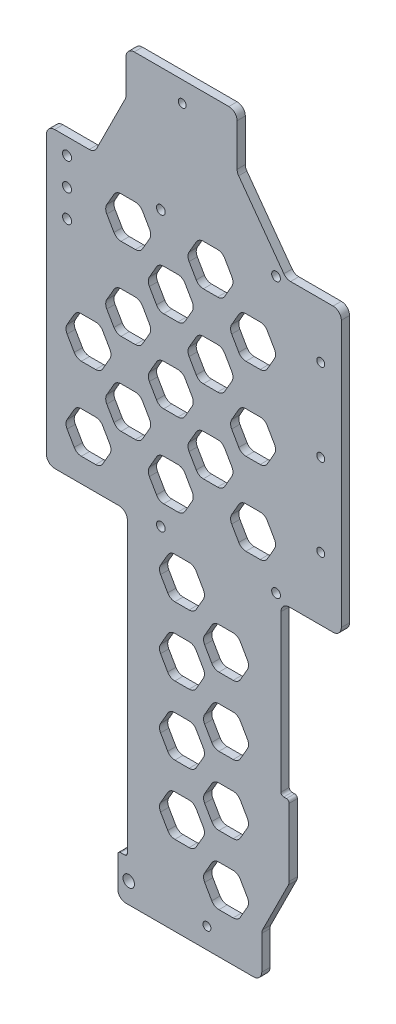
from build123d import *

# Parameters (mm, degrees)
SKETCH_1_R          = 2.1
EXTRUDE_1_DEPTH     = 3
SKETCH_2_R          = 1.45
CUT_EXTRUDE_1_DEPTH = 467.15301821
FILLET_2_R          = 3
FILLET_4_R          = 1
SKETCH_3_R          = 1.6
SKETCH_3_R_2        = 1.65
CUT_EXTRUDE_2_DEPTH = 467.15301821
CUT_EXTRUDE_3_DEPTH = 467.15301821
FILLET_5_R          = 3
SKETCH_6_W          = 103.390482882
SKETCH_6_H          = 284.084054078
CUT_EXTRUDE_5_DEPTH = 467.15301821
FILLET_7_R          = 3


with BuildPart() as part:
    # 草图1 → 凸台-拉伸1 (new body)
    with BuildSketch(Plane.XY):
        Polygon((260.5, -262.80151519), (266.5, -262.80151519), (266.5, -247.80151519), (263, -247.80151519), (263, -138.548780488), (307, -138.548780488), (307, -188.548780488), (307, -247.80151519), (303.5, -247.80151519), (303.5, -262.80151519), (307, -262.80151519), (356, -262.80151519), (356, -246.85724328), (366, -226.85724328), (366, -200.5), (363, -200.5), (363, -139.5), (385, -139.5), (385, -36.5), (364.963101633, -36.5), (347, -11.800735254), (347, 7.5), (306.5, 7.5), (306.5, -8.44427191), (294.972135955, -31.5), (275.027864045, -31.5), (263.5, -8.44427191), (263.5, 7.5), (223, 7.5), (223, -11.800735254), (205.036898367, -36.5), (185, -36.5), (185, -139.5), (207, -139.5), (207, -200.5), (204, -200.5), (204, -226.85724328), (214, -246.85724328), (214, -262.80151519), align=None)
        with Locations((262.5, -255.30151519)):
            Circle(SKETCH_1_R, mode=Mode.SUBTRACT)
        with Locations((307.5, -255.30151519)):
            Circle(SKETCH_1_R, mode=Mode.SUBTRACT)
    extrude(amount=EXTRUDE_1_DEPTH)

    # 草图2 → 切除-拉伸1 (cut, through all)
    with BuildSketch(Plane.XY.offset(3)):
        with Locations((192.5, -56.5)):
            Circle(SKETCH_2_R)
        with Locations((192.5, -86.5)):
            Circle(SKETCH_2_R)
        with Locations((192.5, -116.5)):
            Circle(SKETCH_2_R)
        with Locations((243, 0)):
            Circle(SKETCH_2_R)
        with Locations((234, -255.30151519)):
            Circle(SKETCH_2_R)
        with Locations((377.5, -56.5)):
            Circle(SKETCH_2_R)
        with Locations((327, 0)):
            Circle(SKETCH_2_R)
        with Locations((377.5, -86.5)):
            Circle(SKETCH_2_R)
        with Locations((377.5, -116.5)):
            Circle(SKETCH_2_R)
        with Locations((336, -255.30151519)):
            Circle(SKETCH_2_R)
    extrude(amount=-CUT_EXTRUDE_1_DEPTH, mode=Mode.SUBTRACT)

    # 圆角2
    fillet_2_edges = [part.edges().sort_by_distance(p)[0] for p in [
        (214, -262.80151519, 1.5),
        (214, -246.85724328, 1.5),
        (204, -226.85724328, 1.5),
        (207, -139.5, 1.5),
        (185, -139.5, 1.5),
        (185, -36.5, 1.5),
        (205.036898367, -36.5, 1.5),
        (223, -11.800735254, 1.5),
        (223, 7.5, 1.5),
        (263.5, 7.5, 1.5),
        (263.5, -8.44427191, 1.5),
        (275.027864045, -31.5, 1.5),
        (294.972135955, -31.5, 1.5),
        (306.5, -8.44427191, 1.5),
        (306.5, 7.5, 1.5),
        (347, 7.5, 1.5),
        (385, -36.5, 1.5),
        (385, -139.5, 1.5),
        (363, -139.5, 1.5),
        (366, -226.85724328, 1.5),
        (356, -246.85724328, 1.5),
        (356, -262.80151519, 1.5),
        (347, -11.800735254, 1.5),
        (364.963101633, -36.5, 1.5),
        (303.5, -262.80151519, 1.5),
        (266.5, -262.80151519, 1.5),
        (307, -138.548780488, 1.5),
        (263, -138.548780488, 1.5),
    ]]
    fillet(fillet_2_edges, radius=FILLET_2_R)

    # 圆角4
    fillet_4_edges = [part.edges().sort_by_distance(p)[0] for p in [
        (204, -200.5, 1.5),
        (207, -200.5, 1.5),
        (366, -200.5, 1.5),
        (363, -200.5, 1.5),
        (307, -247.80151519, 1.5),
        (303.5, -247.80151519, 1.5),
        (263, -247.80151519, 1.5),
        (266.5, -247.80151519, 1.5),
    ]]
    fillet(fillet_4_edges, radius=FILLET_4_R)

    # 草图3 → 切除-拉伸2 (cut, through all)
    with BuildSketch(Plane.XY.offset(3)):
        with Locations((319.201373461, -37.5)):
            Circle(SKETCH_3_R)
        with Locations((361.201373461, -37.5)):
            Circle(SKETCH_3_R)
        with Locations((361.201373461, -137.5)):
            Circle(SKETCH_3_R)
        with Locations((319.201373461, -137.5)):
            Circle(SKETCH_3_R)
        with Locations((285, -37.5)):
            Circle(SKETCH_3_R_2)
        with Locations((285, -47.5)):
            Circle(SKETCH_3_R_2)
        with Locations((285, -57.5)):
            Circle(SKETCH_3_R_2)
    extrude(amount=-CUT_EXTRUDE_2_DEPTH, mode=Mode.SUBTRACT)

    # 草图4 → 切除-拉伸3 (cut, through all)
    with BuildSketch(Plane.XY.offset(3)):
        Polygon((255.960695247, -47.20116792), (251.630568228, -39.70116792), (242.97031419, -39.70116792), (238.640187171, -47.20116792), (242.97031419, -54.70116792), (251.630568228, -54.70116792), align=None)
        Polygon((225.960695247, -47.20116792), (221.630568228, -39.70116792), (212.97031419, -39.70116792), (208.640187171, -47.20116792), (212.97031419, -54.70116792), (221.630568228, -54.70116792), align=None)
        Polygon((241.48162596, -62.318127345), (237.151498941, -54.818127345), (228.491244903, -54.818127345), (224.161117884, -62.318127345), (228.491244903, -69.818127345), (237.151498941, -69.818127345), align=None)
        Polygon((271.48162596, -62.318127345), (267.151498941, -54.818127345), (258.491244903, -54.818127345), (254.161117884, -62.318127345), (258.491244903, -69.818127345), (267.151498941, -69.818127345), align=None)
        Polygon((315.960695247, -47.20116792), (311.630568228, -39.70116792), (302.97031419, -39.70116792), (298.640187171, -47.20116792), (302.97031419, -54.70116792), (311.630568228, -54.70116792), align=None)
        Polygon((331.48162596, -62.318127345), (327.151498941, -54.818127345), (318.491244903, -54.818127345), (314.161117884, -62.318127345), (318.491244903, -69.818127345), (327.151498941, -69.818127345), align=None)
        Polygon((345.960695247, -47.20116792), (341.630568228, -39.70116792), (332.97031419, -39.70116792), (328.640187171, -47.20116792), (332.97031419, -54.70116792), (341.630568228, -54.70116792), align=None)
        Polygon((361.48162596, -62.318127345), (357.151498941, -54.818127345), (348.491244903, -54.818127345), (344.161117884, -62.318127345), (348.491244903, -69.818127345), (357.151498941, -69.818127345), align=None)
        Polygon((255.960695247, -77.20116792), (251.630568228, -69.70116792), (242.97031419, -69.70116792), (238.640187171, -77.20116792), (242.97031419, -84.70116792), (251.630568228, -84.70116792), align=None)
        Polygon((271.48162596, -92.318127345), (267.151498941, -84.818127345), (258.491244903, -84.818127345), (254.161117884, -92.318127345), (258.491244903, -99.818127345), (267.151498941, -99.818127345), align=None)
        Polygon((301.48162596, -92.318127345), (297.151498941, -84.818127345), (288.491244903, -84.818127345), (284.161117884, -92.318127345), (288.491244903, -99.818127345), (297.151498941, -99.818127345), align=None)
        Polygon((315.960695247, -77.20116792), (311.630568228, -69.70116792), (302.97031419, -69.70116792), (298.640187171, -77.20116792), (302.97031419, -84.70116792), (311.630568228, -84.70116792), align=None)
        Polygon((331.48162596, -92.318127345), (327.151498941, -84.818127345), (318.491244903, -84.818127345), (314.161117884, -92.318127345), (318.491244903, -99.818127345), (327.151498941, -99.818127345), align=None)
        Polygon((345.960695247, -77.20116792), (341.630568228, -69.70116792), (332.97031419, -69.70116792), (328.640187171, -77.20116792), (332.97031419, -84.70116792), (341.630568228, -84.70116792), align=None)
        Polygon((361.48162596, -92.318127345), (357.151498941, -84.818127345), (348.491244903, -84.818127345), (344.161117884, -92.318127345), (348.491244903, -99.818127345), (357.151498941, -99.818127345), align=None)
        Polygon((255.960695247, -107.20116792), (251.630568228, -99.70116792), (242.97031419, -99.70116792), (238.640187171, -107.20116792), (242.97031419, -114.70116792), (251.630568228, -114.70116792), align=None)
        Polygon((271.48162596, -122.318127345), (267.151498941, -114.818127345), (258.491244903, -114.818127345), (254.161117884, -122.318127345), (258.491244903, -129.818127345), (267.151498941, -129.818127345), align=None)
        Polygon((301.48162596, -122.318127345), (297.151498941, -114.818127345), (288.491244903, -114.818127345), (284.161117884, -122.318127345), (288.491244903, -129.818127345), (297.151498941, -129.818127345), align=None)
        Polygon((315.960695247, -107.20116792), (311.630568228, -99.70116792), (302.97031419, -99.70116792), (298.640187171, -107.20116792), (302.97031419, -114.70116792), (311.630568228, -114.70116792), align=None)
        Polygon((331.48162596, -122.318127345), (327.151498941, -114.818127345), (318.491244903, -114.818127345), (314.161117884, -122.318127345), (318.491244903, -129.818127345), (327.151498941, -129.818127345), align=None)
        Polygon((345.960695247, -107.20116792), (341.630568228, -99.70116792), (332.97031419, -99.70116792), (328.640187171, -107.20116792), (332.97031419, -114.70116792), (341.630568228, -114.70116792), align=None)
        Polygon((361.48162596, -122.318127345), (357.151498941, -114.818127345), (348.491244903, -114.818127345), (344.161117884, -122.318127345), (348.491244903, -129.818127345), (357.151498941, -129.818127345), align=None)
        Polygon((225.960695247, -77.20116792), (221.630568228, -69.70116792), (212.97031419, -69.70116792), (208.640187171, -77.20116792), (212.97031419, -84.70116792), (221.630568228, -84.70116792), align=None)
        Polygon((241.48162596, -92.318127345), (237.151498941, -84.818127345), (228.491244903, -84.818127345), (224.161117884, -92.318127345), (228.491244903, -99.818127345), (237.151498941, -99.818127345), align=None)
        Polygon((225.960695247, -107.20116792), (221.630568228, -99.70116792), (212.97031419, -99.70116792), (208.640187171, -107.20116792), (212.97031419, -114.70116792), (221.630568228, -114.70116792), align=None)
        Polygon((241.48162596, -122.318127345), (237.151498941, -114.818127345), (228.491244903, -114.818127345), (224.161117884, -122.318127345), (228.491244903, -129.818127345), (237.151498941, -129.818127345), align=None)
        Polygon((335.56554436, -151.209600954), (331.235417341, -143.709600954), (322.575163303, -143.709600954), (318.245036285, -151.209600954), (322.575163303, -158.709600954), (331.235417341, -158.709600954), align=None)
        Polygon((235.56554436, -151.209600954), (231.235417341, -143.709600954), (222.575163303, -143.709600954), (218.245036285, -151.209600954), (222.575163303, -158.709600954), (231.235417341, -158.709600954), align=None)
        Polygon((251.630568228, -165.38416339), (247.300441209, -157.88416339), (238.640187171, -157.88416339), (234.310060152, -165.38416339), (238.640187171, -172.88416339), (247.300441209, -172.88416339), align=None)
        Polygon((351.630568228, -165.38416339), (347.300441209, -157.88416339), (338.640187171, -157.88416339), (334.310060152, -165.38416339), (338.640187171, -172.88416339), (347.300441209, -172.88416339), align=None)
        Polygon((335.56554436, -176.209600954), (331.235417341, -168.709600954), (322.575163303, -168.709600954), (318.245036285, -176.209600954), (322.575163303, -183.709600954), (331.235417341, -183.709600954), align=None)
        Polygon((351.630568228, -190.38416339), (347.300441209, -182.88416339), (338.640187171, -182.88416339), (334.310060152, -190.38416339), (338.640187171, -197.88416339), (347.300441209, -197.88416339), align=None)
        Polygon((335.56554436, -201.209600954), (331.235417341, -193.709600954), (322.575163303, -193.709600954), (318.245036285, -201.209600954), (322.575163303, -208.709600954), (331.235417341, -208.709600954), align=None)
        Polygon((351.630568228, -215.38416339), (347.300441209, -207.88416339), (338.640187171, -207.88416339), (334.310060152, -215.38416339), (338.640187171, -222.88416339), (347.300441209, -222.88416339), align=None)
        Polygon((335.56554436, -226.209600954), (331.235417341, -218.709600954), (322.575163303, -218.709600954), (318.245036285, -226.209600954), (322.575163303, -233.709600954), (331.235417341, -233.709600954), align=None)
        Polygon((351.630568228, -240.38416339), (347.300441209, -232.88416339), (338.640187171, -232.88416339), (334.310060152, -240.38416339), (338.640187171, -247.88416339), (347.300441209, -247.88416339), align=None)
        Polygon((235.56554436, -176.209600954), (231.235417341, -168.709600954), (222.575163303, -168.709600954), (218.245036285, -176.209600954), (222.575163303, -183.709600954), (231.235417341, -183.709600954), align=None)
        Polygon((251.630568228, -190.38416339), (247.300441209, -182.88416339), (238.640187171, -182.88416339), (234.310060152, -190.38416339), (238.640187171, -197.88416339), (247.300441209, -197.88416339), align=None)
        Polygon((235.56554436, -201.209600954), (231.235417341, -193.709600954), (222.575163303, -193.709600954), (218.245036285, -201.209600954), (222.575163303, -208.709600954), (231.235417341, -208.709600954), align=None)
        Polygon((251.630568228, -215.38416339), (247.300441209, -207.88416339), (238.640187171, -207.88416339), (234.310060152, -215.38416339), (238.640187171, -222.88416339), (247.300441209, -222.88416339), align=None)
        Polygon((235.56554436, -226.209600954), (231.235417341, -218.709600954), (222.575163303, -218.709600954), (218.245036285, -226.209600954), (222.575163303, -233.709600954), (231.235417341, -233.709600954), align=None)
        Polygon((251.630568228, -240.38416339), (247.300441209, -232.88416339), (238.640187171, -232.88416339), (234.310060152, -240.38416339), (238.640187171, -247.88416339), (247.300441209, -247.88416339), align=None)
    extrude(amount=-CUT_EXTRUDE_3_DEPTH, mode=Mode.SUBTRACT)

    # 圆角5
    fillet_5_edges = [part.edges().sort_by_distance(p)[0] for p in [
        (221.630568228, -54.70116792, 1.5),
        (212.97031419, -54.70116792, 1.5),
        (208.640187171, -47.20116792, 1.5),
        (225.960695247, -47.20116792, 1.5),
        (347.300441209, -247.88416339, 1.5),
        (338.640187171, -247.88416339, 1.5),
        (334.310060152, -240.38416339, 1.5),
        (338.640187171, -232.88416339, 1.5),
        (347.300441209, -232.88416339, 1.5),
        (351.630568228, -240.38416339, 1.5),
        (231.235417341, -183.709600954, 1.5),
        (222.575163303, -183.709600954, 1.5),
        (218.245036285, -176.209600954, 1.5),
        (222.575163303, -168.709600954, 1.5),
        (231.235417341, -168.709600954, 1.5),
        (235.56554436, -176.209600954, 1.5),
        (231.235417341, -208.709600954, 1.5),
        (222.575163303, -208.709600954, 1.5),
        (218.245036285, -201.209600954, 1.5),
        (222.575163303, -193.709600954, 1.5),
        (231.235417341, -193.709600954, 1.5),
        (235.56554436, -201.209600954, 1.5),
        (247.300441209, -197.88416339, 1.5),
        (238.640187171, -197.88416339, 1.5),
        (234.310060152, -190.38416339, 1.5),
        (238.640187171, -182.88416339, 1.5),
        (247.300441209, -182.88416339, 1.5),
        (251.630568228, -190.38416339, 1.5),
        (331.235417341, -208.709600954, 1.5),
        (322.575163303, -208.709600954, 1.5),
        (318.245036285, -201.209600954, 1.5),
        (322.575163303, -193.709600954, 1.5),
        (331.235417341, -193.709600954, 1.5),
        (335.56554436, -201.209600954, 1.5),
        (347.300441209, -197.88416339, 1.5),
        (338.640187171, -197.88416339, 1.5),
        (334.310060152, -190.38416339, 1.5),
        (338.640187171, -182.88416339, 1.5),
        (347.300441209, -182.88416339, 1.5),
        (351.630568228, -190.38416339, 1.5),
        (331.235417341, -233.709600954, 1.5),
        (322.575163303, -233.709600954, 1.5),
        (318.245036285, -226.209600954, 1.5),
        (322.575163303, -218.709600954, 1.5),
        (331.235417341, -218.709600954, 1.5),
        (335.56554436, -226.209600954, 1.5),
        (347.300441209, -222.88416339, 1.5),
        (338.640187171, -222.88416339, 1.5),
        (334.310060152, -215.38416339, 1.5),
        (338.640187171, -207.88416339, 1.5),
        (347.300441209, -207.88416339, 1.5),
        (351.630568228, -215.38416339, 1.5),
        (247.300441209, -247.88416339, 1.5),
        (238.640187171, -247.88416339, 1.5),
        (234.310060152, -240.38416339, 1.5),
        (238.640187171, -232.88416339, 1.5),
        (247.300441209, -232.88416339, 1.5),
        (251.630568228, -240.38416339, 1.5),
        (247.300441209, -222.88416339, 1.5),
        (238.640187171, -222.88416339, 1.5),
        (234.310060152, -215.38416339, 1.5),
        (238.640187171, -207.88416339, 1.5),
        (247.300441209, -207.88416339, 1.5),
        (251.630568228, -215.38416339, 1.5),
        (231.235417341, -233.709600954, 1.5),
        (222.575163303, -233.709600954, 1.5),
        (218.245036285, -226.209600954, 1.5),
        (222.575163303, -218.709600954, 1.5),
        (231.235417341, -218.709600954, 1.5),
        (235.56554436, -226.209600954, 1.5),
        (311.630568228, -84.70116792, 1.5),
        (302.97031419, -84.70116792, 1.5),
        (298.640187171, -77.20116792, 1.5),
        (302.97031419, -69.70116792, 1.5),
        (311.630568228, -69.70116792, 1.5),
        (315.960695247, -77.20116792, 1.5),
        (297.151498941, -99.818127345, 1.5),
        (288.491244903, -99.818127345, 1.5),
        (284.161117884, -92.318127345, 1.5),
        (288.491244903, -84.818127345, 1.5),
        (297.151498941, -84.818127345, 1.5),
        (301.48162596, -92.318127345, 1.5),
        (267.151498941, -99.818127345, 1.5),
        (258.491244903, -99.818127345, 1.5),
        (254.161117884, -92.318127345, 1.5),
        (258.491244903, -84.818127345, 1.5),
        (267.151498941, -84.818127345, 1.5),
        (271.48162596, -92.318127345, 1.5),
        (251.630568228, -114.70116792, 1.5),
        (242.97031419, -114.70116792, 1.5),
        (238.640187171, -107.20116792, 1.5),
        (242.97031419, -99.70116792, 1.5),
        (251.630568228, -99.70116792, 1.5),
        (255.960695247, -107.20116792, 1.5),
        (357.151498941, -99.818127345, 1.5),
        (348.491244903, -99.818127345, 1.5),
        (344.161117884, -92.318127345, 1.5),
        (348.491244903, -84.818127345, 1.5),
        (357.151498941, -84.818127345, 1.5),
        (361.48162596, -92.318127345, 1.5),
        (341.630568228, -84.70116792, 1.5),
        (332.97031419, -84.70116792, 1.5),
        (328.640187171, -77.20116792, 1.5),
        (332.97031419, -69.70116792, 1.5),
        (341.630568228, -69.70116792, 1.5),
        (345.960695247, -77.20116792, 1.5),
        (327.151498941, -99.818127345, 1.5),
        (318.491244903, -99.818127345, 1.5),
        (314.161117884, -92.318127345, 1.5),
        (318.491244903, -84.818127345, 1.5),
        (327.151498941, -84.818127345, 1.5),
        (331.48162596, -92.318127345, 1.5),
        (311.630568228, -54.70116792, 1.5),
        (302.97031419, -54.70116792, 1.5),
        (298.640187171, -47.20116792, 1.5),
        (302.97031419, -39.70116792, 1.5),
        (311.630568228, -39.70116792, 1.5),
        (315.960695247, -47.20116792, 1.5),
        (267.151498941, -69.818127345, 1.5),
        (258.491244903, -69.818127345, 1.5),
        (254.161117884, -62.318127345, 1.5),
        (258.491244903, -54.818127345, 1.5),
        (267.151498941, -54.818127345, 1.5),
        (271.48162596, -62.318127345, 1.5),
        (237.151498941, -69.818127345, 1.5),
        (228.491244903, -69.818127345, 1.5),
        (224.161117884, -62.318127345, 1.5),
        (228.491244903, -54.818127345, 1.5),
        (237.151498941, -54.818127345, 1.5),
        (241.48162596, -62.318127345, 1.5),
        (251.630568228, -54.70116792, 1.5),
        (242.97031419, -54.70116792, 1.5),
        (238.640187171, -47.20116792, 1.5),
        (242.97031419, -39.70116792, 1.5),
        (251.630568228, -39.70116792, 1.5),
        (255.960695247, -47.20116792, 1.5),
        (251.630568228, -84.70116792, 1.5),
        (242.97031419, -84.70116792, 1.5),
        (238.640187171, -77.20116792, 1.5),
        (242.97031419, -69.70116792, 1.5),
        (251.630568228, -69.70116792, 1.5),
        (255.960695247, -77.20116792, 1.5),
        (357.151498941, -69.818127345, 1.5),
        (348.491244903, -69.818127345, 1.5),
        (344.161117884, -62.318127345, 1.5),
        (348.491244903, -54.818127345, 1.5),
        (357.151498941, -54.818127345, 1.5),
        (361.48162596, -62.318127345, 1.5),
        (341.630568228, -54.70116792, 1.5),
        (332.97031419, -54.70116792, 1.5),
        (328.640187171, -47.20116792, 1.5),
        (332.97031419, -39.70116792, 1.5),
        (341.630568228, -39.70116792, 1.5),
        (345.960695247, -47.20116792, 1.5),
        (327.151498941, -69.818127345, 1.5),
        (318.491244903, -69.818127345, 1.5),
        (314.161117884, -62.318127345, 1.5),
        (318.491244903, -54.818127345, 1.5),
        (327.151498941, -54.818127345, 1.5),
        (331.48162596, -62.318127345, 1.5),
        (221.630568228, -114.70116792, 1.5),
        (212.97031419, -114.70116792, 1.5),
        (208.640187171, -107.20116792, 1.5),
        (212.97031419, -99.70116792, 1.5),
        (221.630568228, -99.70116792, 1.5),
        (225.960695247, -107.20116792, 1.5),
        (237.151498941, -99.818127345, 1.5),
        (228.491244903, -99.818127345, 1.5),
        (224.161117884, -92.318127345, 1.5),
        (228.491244903, -84.818127345, 1.5),
        (237.151498941, -84.818127345, 1.5),
        (241.48162596, -92.318127345, 1.5),
        (237.151498941, -129.818127345, 1.5),
        (228.491244903, -129.818127345, 1.5),
        (224.161117884, -122.318127345, 1.5),
        (228.491244903, -114.818127345, 1.5),
        (237.151498941, -114.818127345, 1.5),
        (241.48162596, -122.318127345, 1.5),
        (231.235417341, -158.709600954, 1.5),
        (222.575163303, -158.709600954, 1.5),
        (218.245036285, -151.209600954, 1.5),
        (222.575163303, -143.709600954, 1.5),
        (231.235417341, -143.709600954, 1.5),
        (235.56554436, -151.209600954, 1.5),
        (347.300441209, -172.88416339, 1.5),
        (338.640187171, -172.88416339, 1.5),
        (334.310060152, -165.38416339, 1.5),
        (338.640187171, -157.88416339, 1.5),
        (347.300441209, -157.88416339, 1.5),
        (351.630568228, -165.38416339, 1.5),
        (331.235417341, -183.709600954, 1.5),
        (322.575163303, -183.709600954, 1.5),
        (318.245036285, -176.209600954, 1.5),
        (322.575163303, -168.709600954, 1.5),
        (331.235417341, -168.709600954, 1.5),
        (335.56554436, -176.209600954, 1.5),
        (247.300441209, -172.88416339, 1.5),
        (238.640187171, -172.88416339, 1.5),
        (234.310060152, -165.38416339, 1.5),
        (238.640187171, -157.88416339, 1.5),
        (247.300441209, -157.88416339, 1.5),
        (251.630568228, -165.38416339, 1.5),
        (331.235417341, -158.709600954, 1.5),
        (322.575163303, -158.709600954, 1.5),
        (318.245036285, -151.209600954, 1.5),
        (322.575163303, -143.709600954, 1.5),
        (331.235417341, -143.709600954, 1.5),
        (335.56554436, -151.209600954, 1.5),
        (311.630568228, -114.70116792, 1.5),
        (302.97031419, -114.70116792, 1.5),
        (298.640187171, -107.20116792, 1.5),
        (302.97031419, -99.70116792, 1.5),
        (311.630568228, -99.70116792, 1.5),
        (315.960695247, -107.20116792, 1.5),
        (297.151498941, -129.818127345, 1.5),
        (288.491244903, -129.818127345, 1.5),
        (284.161117884, -122.318127345, 1.5),
        (288.491244903, -114.818127345, 1.5),
        (297.151498941, -114.818127345, 1.5),
        (301.48162596, -122.318127345, 1.5),
        (267.151498941, -129.818127345, 1.5),
        (258.491244903, -129.818127345, 1.5),
        (254.161117884, -122.318127345, 1.5),
        (258.491244903, -114.818127345, 1.5),
        (267.151498941, -114.818127345, 1.5),
        (271.48162596, -122.318127345, 1.5),
        (221.630568228, -84.70116792, 1.5),
        (212.97031419, -84.70116792, 1.5),
        (208.640187171, -77.20116792, 1.5),
        (212.97031419, -69.70116792, 1.5),
        (221.630568228, -69.70116792, 1.5),
        (225.960695247, -77.20116792, 1.5),
        (357.151498941, -129.818127345, 1.5),
        (348.491244903, -129.818127345, 1.5),
        (344.161117884, -122.318127345, 1.5),
        (348.491244903, -114.818127345, 1.5),
        (357.151498941, -114.818127345, 1.5),
        (361.48162596, -122.318127345, 1.5),
        (341.630568228, -114.70116792, 1.5),
        (332.97031419, -114.70116792, 1.5),
        (328.640187171, -107.20116792, 1.5),
        (332.97031419, -99.70116792, 1.5),
        (341.630568228, -99.70116792, 1.5),
        (345.960695247, -107.20116792, 1.5),
        (327.151498941, -129.818127345, 1.5),
        (318.491244903, -129.818127345, 1.5),
        (314.161117884, -122.318127345, 1.5),
        (318.491244903, -114.818127345, 1.5),
        (327.151498941, -114.818127345, 1.5),
        (331.48162596, -122.318127345, 1.5),
        (221.630568228, -39.70116792, 1.5),
        (212.97031419, -39.70116792, 1.5),
    ]]
    fillet(fillet_5_edges, radius=FILLET_5_R)

    # 草图6 → 切除-拉伸5 (cut, through all)
    with BuildSketch(Plane.XY.offset(3)):
        with Locations((225.804758559, -128.226214828)):
            Rectangle(SKETCH_6_W, SKETCH_6_H)
    extrude(amount=-CUT_EXTRUDE_5_DEPTH, mode=Mode.SUBTRACT)

    # 圆角7
    fillet_7_edges = [part.edges().sort_by_distance(p)[0] for p in [
        (277.5, -138.548780488, 1.5),
        (277.5, -31.5, 1.5),
    ]]
    fillet(fillet_7_edges, radius=FILLET_7_R)


solid = part.part
